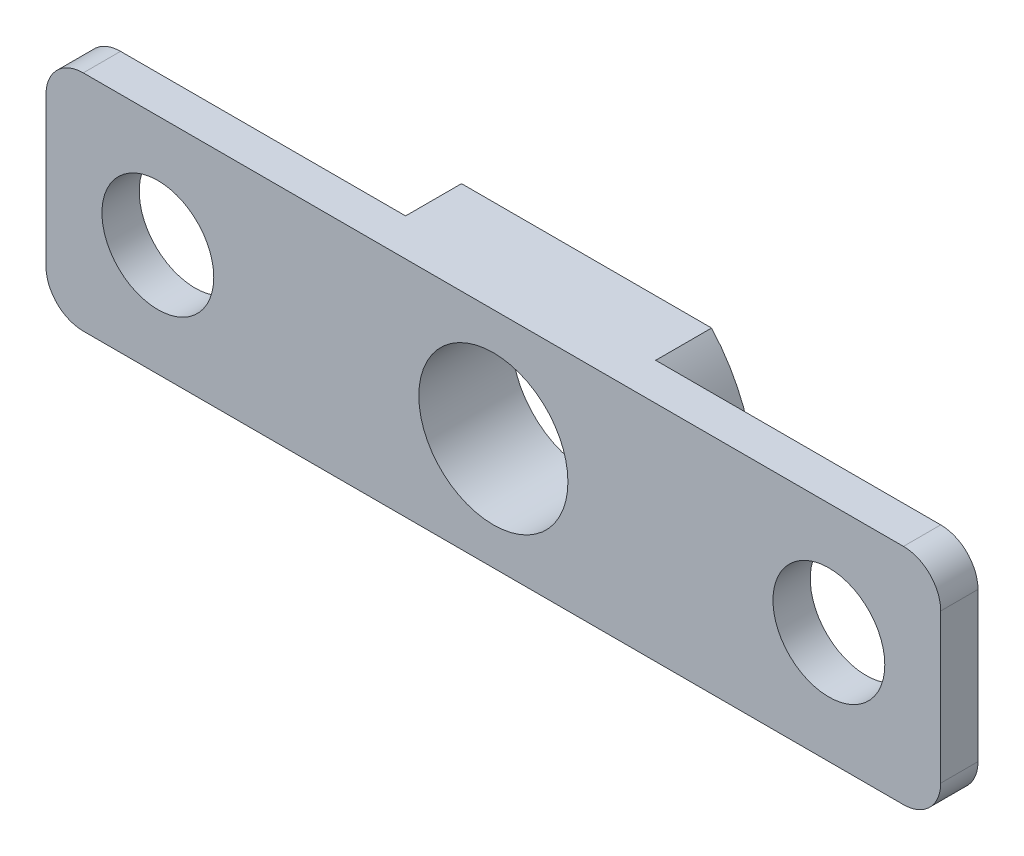
from build123d import *
from build123d.topology import SkipClean

# Parameters (mm, degrees)
SKETCH1_W           = 24
SKETCH1_H           = 6
SKETCH1_R           = 1.5
SKETCH1_R_2         = 2
BOSS_EXTRUDE2_DEPTH = 1
FILLET1_R           = 1
FILLET2_R           = 1
BOSS_EXTRUDE3_START = 1.5
SKETCH2_R           = 2
BOSS_EXTRUDE3_DEPTH = 1.5


with BuildPart() as part:
    # Sketch1 → Boss-Extrude2 (new body)
    with BuildSketch(Plane.XY):
        with Locations((9, 0)):
            Rectangle(SKETCH1_W, SKETCH1_H)
        Circle(SKETCH1_R, mode=Mode.SUBTRACT)
        with Locations((18, 0)):
            Circle(SKETCH1_R, mode=Mode.SUBTRACT)
        with Locations((9, 0)):
            Circle(SKETCH1_R_2, mode=Mode.SUBTRACT)
    extrude(amount=BOSS_EXTRUDE2_DEPTH)

    # Fillet1
    fillet1_edges = [part.edges().sort_by_distance(p)[0] for p in [
        (-3, 3, 0.5),
    ]]
    fillet(fillet1_edges, radius=FILLET1_R)

    # Fillet2
    fillet2_edges = [part.edges().sort_by_distance(p)[0] for p in [
        (21, 3, 0.5),
        (21, -3, 0.5),
        (-3, -3, 0.5),
    ]]
    fillet(fillet2_edges, radius=FILLET2_R)

    # Sketch2 → Boss-Extrude3 (add)
    with SkipClean():  # the faces are left unmerged after this step: merging them gives an invalid solid
        with BuildSketch(Plane(origin=(0, 0, 0), x_dir=(-1, 0, 0), z_dir=(0, 0, -1)).offset(BOSS_EXTRUDE3_START)):
            with BuildLine():
                Line((-12.354101966, -3), (-5.645898034, -3))
                ThreePointArc((-5.645898034, -3), (-4.5, 0), (-5.645898034, 3))
                Line((-5.645898034, 3), (-12.354101966, 3))
                ThreePointArc((-12.354101966, 3), (-13.5, 0), (-12.354101966, -3))
            make_face()
            with Locations((-9, 0)):
                Circle(SKETCH2_R, mode=Mode.SUBTRACT)
        extrude(amount=-BOSS_EXTRUDE3_DEPTH)


solid = part.part
